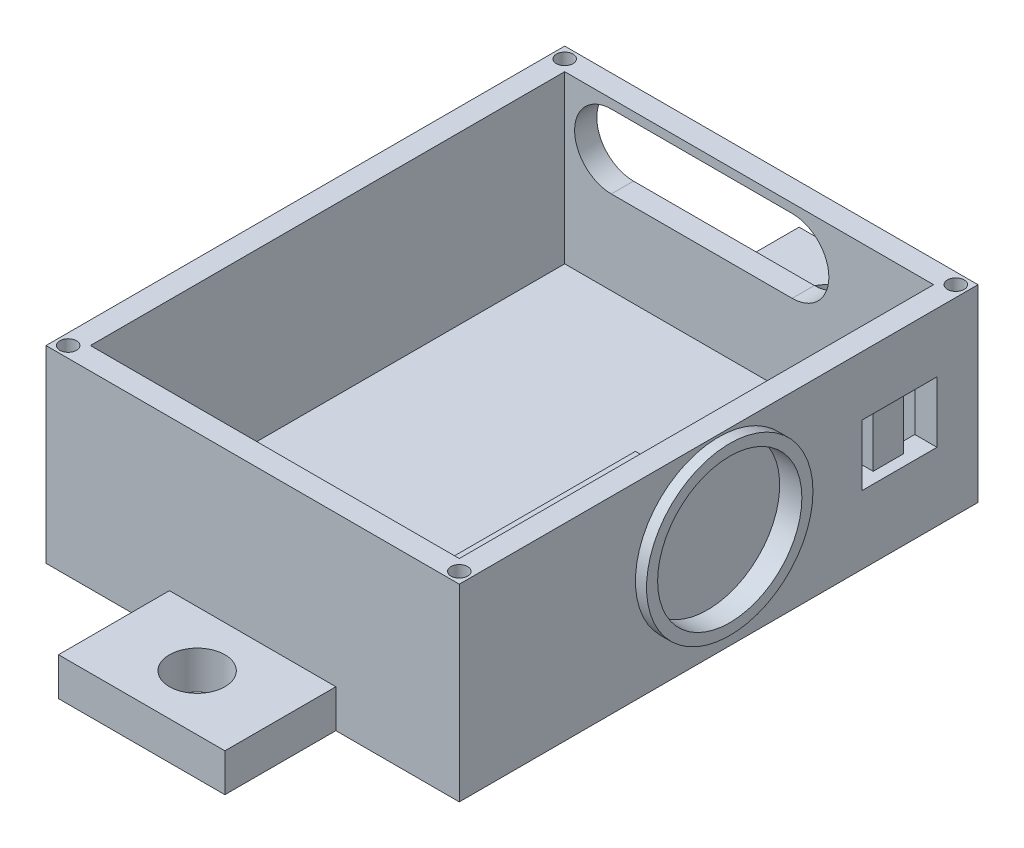
from build123d import *

# Parameters (mm, degrees)
SKETCH2_W           = 74.5
SKETCH2_H           = 93.5
BOSS_EXTRUDE1_DEPTH = 34
SHELL1_T            = -4
SKETCH4_R           = 15
BOSS_EXTRUDE2_DEPTH = 2
SHELL2_START        = 35.25
SHELL2_OUTLINE_R    = 13
SHELL2_DEPTH        = 4
SKETCH5_W           = 33
SKETCH5_H           = 17
BOSS_EXTRUDE3_DEPTH = 11
SHELL3_START        = 24.25
SHELL3_OUTLINE_W    = 15
SHELL3_OUTLINE_H    = 29
SHELL3_DEPTH        = 9
SHELL3_START_2      = 33.25
SHELL3_2_DEPTH      = 2
SKETCH8_W           = 4.5
SKETCH8_H           = 15
CUT_EXTRUDE1_DEPTH  = 7
SKETCH9_R           = 1.5
CUT_EXTRUDE3_DEPTH  = 7
SKETCH10_W          = 13.5
SKETCH10_H          = 11
CUT_EXTRUDE5_DEPTH  = 2
SKETCH11_W          = 4
SKETCH11_H          = 11
CUT_EXTRUDE6_DEPTH  = 12
CUT_EXTRUDE7_DEPTH  = 10
SKETCH13_W          = 30
SKETCH13_H          = 6.856904394
BOSS_EXTRUDE6_DEPTH = 20
SKETCH19_W          = 30
SKETCH19_H          = 6.86
BOSS_EXTRUDE7_DEPTH = 20
SKETCH20_R          = 5
CUT_EXTRUDE8_DEPTH  = 20
SKETCH21_R          = 5
CUT_EXTRUDE9_DEPTH  = 20


# Read off the part's stored shape, not the designer's step: Shell2, Shell3
with BuildPart() as part:
    # Sketch2 → Boss-Extrude1 (new body)
    with BuildSketch(Plane(origin=(0, 0, 0), x_dir=(1, 0, 0), z_dir=(0, 1, 0))):
        Rectangle(SKETCH2_W, SKETCH2_H)
    extrude(amount=BOSS_EXTRUDE1_DEPTH)

    # Shell1
    shell1_openings = [part.faces().sort_by_distance(p)[0] for p in [
        (0, 34, 0),
    ]]
    offset(amount=SHELL1_T, openings=shell1_openings, kind=Kind.INTERSECTION)

    # Sketch4 → Boss-Extrude2 (add)
    with BuildSketch(Plane(origin=(37.25, 0, 0), x_dir=(0, 0, -1), z_dir=(1, 0, 0))):
        with Locations((0, 18.6)):
            Circle(SKETCH4_R)
    extrude(amount=BOSS_EXTRUDE2_DEPTH)

    # Shell2 outline → Shell2 (cut)
    with BuildSketch(Plane.YZ.offset(SHELL2_START)):
        with Locations((18.6, 0)):
            Circle(SHELL2_OUTLINE_R)
    extrude(amount=SHELL2_DEPTH, mode=Mode.SUBTRACT)

    # Sketch5 → Boss-Extrude3 (add)
    with BuildSketch(Plane.ZY.offset(-33.25)):
        with Locations((16.5, 15.356904394)):
            Rectangle(SKETCH5_W, SKETCH5_H)
    extrude(amount=BOSS_EXTRUDE3_DEPTH)

    # Shell3 outline → Shell3 (cut)
    with BuildSketch(Plane.YZ.offset(SHELL3_START)):
        with Locations((16.356904394, 16.5)):
            Rectangle(SHELL3_OUTLINE_W, SHELL3_OUTLINE_H)
    extrude(amount=SHELL3_DEPTH, mode=Mode.SUBTRACT)

    # Shell3 2 outline → Shell3 2 (cut)
    with BuildSketch(Plane.YZ.offset(SHELL3_START_2)):
        with BuildLine():
            Line((8.856904394, 31), (8.856904394, 11.404915081))
            ThreePointArc((8.856904394, 11.404915081), (15.996381403, 14.77231093), (23.856904394, 14.048663858))
            Line((23.856904394, 14.048663858), (23.856904394, 31))
            Line((23.856904394, 31), (8.856904394, 31))
        make_face()
    extrude(amount=SHELL3_2_DEPTH, mode=Mode.SUBTRACT)

    # Sketch8 → Cut-Extrude1 (cut)
    with BuildSketch(Plane(origin=(0, 0, 31), x_dir=(-1, 0, 0), z_dir=(0, 0, -1))):
        with Locations((-26.5, 16.356904394)):
            Rectangle(SKETCH8_W, SKETCH8_H)
    extrude(amount=-CUT_EXTRUDE1_DEPTH, mode=Mode.SUBTRACT)

    # Sketch9 → Cut-Extrude3 (cut)
    with BuildSketch(Plane(origin=(0, 34, 0), x_dir=(1, 0, 0), z_dir=(0, 1, 0))):
        with Locations(Location((-35.25, -44.75, 0), (0, 0, 270))):
            Circle(SKETCH9_R)
        with Locations(Location((35.25, -44.75, 0), (0, 0, 270))):
            Circle(SKETCH9_R)
        with Locations(Location((35.25, 44.75, 0), (0, 0, 270))):
            Circle(SKETCH9_R)
        with Locations(Location((-35.25, 44.75, 0), (0, 0, 270))):
            Circle(SKETCH9_R)
    extrude(amount=-CUT_EXTRUDE3_DEPTH, mode=Mode.SUBTRACT)

    # Sketch10 → Cut-Extrude5 (cut)
    with BuildSketch(Plane(origin=(37.25, 0, 0), x_dir=(0, 0, -1), z_dir=(1, 0, 0))):
        with Locations((32.604466308, 17.811561776)):
            Rectangle(SKETCH10_W, SKETCH10_H)
    extrude(amount=-CUT_EXTRUDE5_DEPTH, mode=Mode.SUBTRACT)

    # Sketch11 → Cut-Extrude6 (cut)
    with BuildSketch(Plane(origin=(35.25, 0, 0), x_dir=(0, 0, -1), z_dir=(1, 0, 0))):
        with Locations((27.854466308, 17.811561776)):
            Rectangle(SKETCH11_W, SKETCH11_H)
        with Locations((37.354466308, 17.811561776)):
            Rectangle(SKETCH11_W, SKETCH11_H)
    extrude(amount=-CUT_EXTRUDE6_DEPTH, mode=Mode.SUBTRACT)

    # Sketch12 → Cut-Extrude7 (cut)
    with BuildSketch(Plane(origin=(0, 0, -46.75), x_dir=(-1, 0, 0), z_dir=(0, 0, -1))):
        with BuildLine():
            Line((-7.742051662, 32.367861053), (24.842051662, 32.367861053))
            ThreePointArc((24.842051662, 32.367861053), (31.467861053, 25.742051662), (24.842051662, 19.11624227))
            Line((24.842051662, 19.11624227), (-7.742051662, 19.11624227))
            ThreePointArc((-7.742051662, 19.11624227), (-14.367861053, 25.742051662), (-7.742051662, 32.367861053))
        make_face()
    extrude(amount=-CUT_EXTRUDE7_DEPTH, mode=Mode.SUBTRACT)

    # Sketch13 → Boss-Extrude6 (add)
    with BuildSketch(Plane(origin=(0, 0, -46.75), x_dir=(-1, 0, 0), z_dir=(0, 0, -1))):
        with Locations((0, 3.428452197)):
            Rectangle(SKETCH13_W, SKETCH13_H)
    extrude(amount=BOSS_EXTRUDE6_DEPTH)

    # Sketch19 → Boss-Extrude7 (add)
    with BuildSketch(Plane.XY.offset(46.75)):
        with Locations((0, 3.43)):
            Rectangle(SKETCH19_W, SKETCH19_H)
    extrude(amount=BOSS_EXTRUDE7_DEPTH)

    # Sketch20 → Cut-Extrude8 (cut)
    with BuildSketch(Plane(origin=(0, 6.856904394, 0), x_dir=(1, 0, 0), z_dir=(0, 1, 0))):
        with Locations(Location((0, 56.75, 0), (0, 0, 270))):
            Circle(SKETCH20_R)
    extrude(amount=-CUT_EXTRUDE8_DEPTH, mode=Mode.SUBTRACT)

    # Sketch21 → Cut-Extrude9 (cut)
    with BuildSketch(Plane(origin=(0, 6.86, 0), x_dir=(1, 0, 0), z_dir=(0, 1, 0))):
        with Locations(Location((0, -56.75, 0), (0, 0, 270))):
            Circle(SKETCH21_R)
    extrude(amount=-CUT_EXTRUDE9_DEPTH, mode=Mode.SUBTRACT)


solid = part.part
